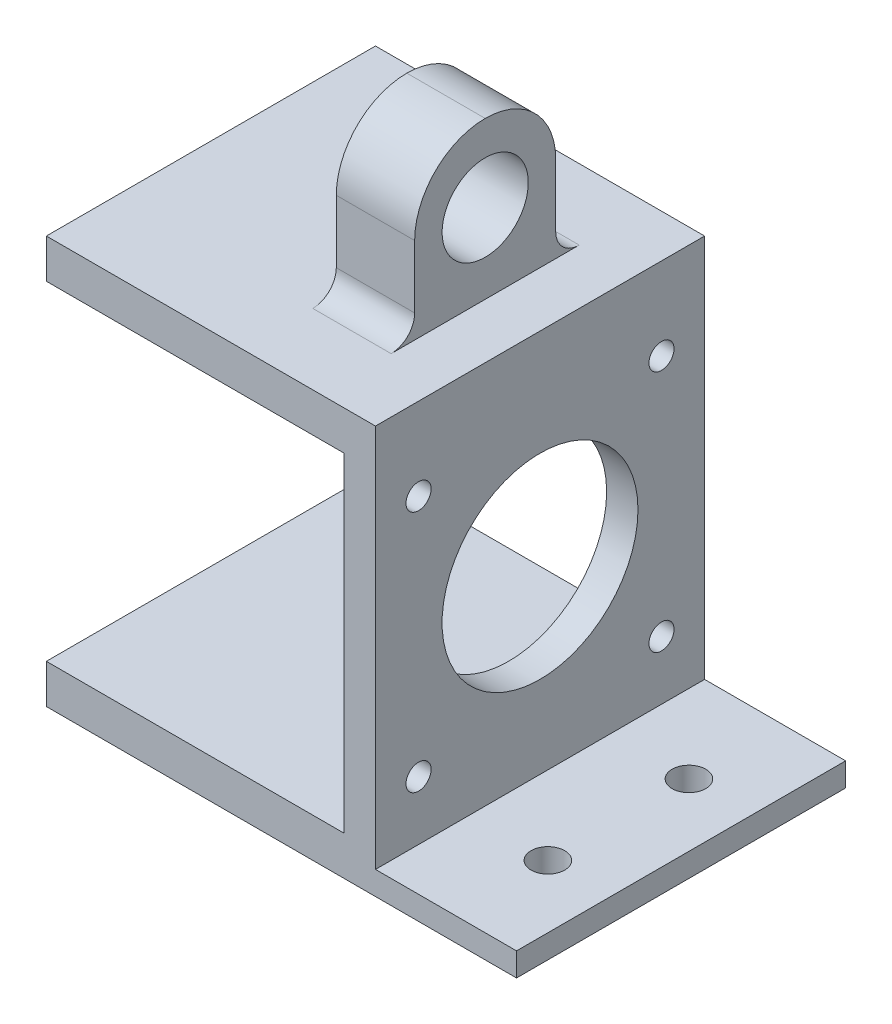
from build123d import *

# Parameters (mm, degrees)
SKETCH1_W            = 94
SKETCH1_H            = 42
BOSS_EXTRUDE1_DEPTH  = 3
SKETCH2_W            = 4
SKETCH2_H            = 42
BOSS_EXTRUDE2_DEPTH  = 47
SKETCH3_R            = 12.5
SKETCH3_R_2          = 1.6
CUT_EXTRUDE1_DEPTH   = 114.176852757
SKETCH4_W            = 42
SKETCH4_H            = 5
BOSS_EXTRUDE3_DEPTH  = 40
SKETCH5_W            = 42
SKETCH5_H            = 5
BOSS_EXTRUDE4_DEPTH  = 38
SKETCH7_W            = 42
SKETCH7_H            = 42
SKETCH7_W_2          = 44
BOSS_EXTRUDE6_DEPTH  = 5
SKETCH9_R            = 2.15
CUT_EXTRUDE2_DEPTH   = 149.731301346
SKETCH11_W           = 10
SKETCH11_H           = 18
BOSS_EXTRUDE7_DEPTH  = 20
SKETCH13_R           = 5.5
CUT_EXTRUDE3_DEPTH   = 169.988165266
BOSS_EXTRUDE11_DEPTH = 5
SKETCH23_W           = 10
SKETCH23_H           = 26
BOSS_EXTRUDE12_DEPTH = 50
CUT_EXTRUDE7_DEPTH   = 193.595430891
SKETCH25_W           = 10
SKETCH25_H           = 18
BOSS_EXTRUDE13_DEPTH = 20
SKETCH26_R           = 5.5
CUT_EXTRUDE8_DEPTH   = 193.595430891
SKETCH27_W           = 12
SKETCH27_H           = 18
BOSS_EXTRUDE14_DEPTH = 69
CUT_EXTRUDE10_START  = -5
SKETCH28_R           = 5.5
CUT_EXTRUDE10_DEPTH  = 5
SKETCH29_R           = 5.5
CUT_EXTRUDE11_DEPTH  = 5
FILLET4_R            = 9
FILLET3_R            = 3
SKETCH30_W           = 112
SKETCH30_H           = 120
CUT_EXTRUDE13_DEPTH  = 181.413414135


# Some blends are built 0.0001 mm under size
with BuildPart() as part:
    # Sketch1 → Boss-Extrude1 (new body)
    with BuildSketch(Plane(origin=(0, 0, 0), x_dir=(1, 0, 0), z_dir=(0, 1, 0))):
        with Locations((47, -21)):
            Rectangle(SKETCH1_W, SKETCH1_H)
    extrude(amount=BOSS_EXTRUDE1_DEPTH)

    # Sketch2 → Boss-Extrude2 (add)
    with BuildSketch(Plane.XZ):
        with Locations((2, 21)):
            Rectangle(SKETCH2_W, SKETCH2_H)
        with Locations((92, 21)):
            Rectangle(SKETCH2_W, SKETCH2_H)
    extrude(amount=-BOSS_EXTRUDE2_DEPTH)

    # Sketch3 → Cut-Extrude1 (cut, through all)
    with BuildSketch(Plane(origin=(94, 0, 0), x_dir=(0, 0, -1), z_dir=(1, 0, 0))):
        with Locations((-21, 26)):
            Circle(SKETCH3_R)
        with Locations((-36.5, 41.5)):
            Circle(SKETCH3_R_2)
        with Locations((-5.5, 41.5)):
            Circle(SKETCH3_R_2)
        with Locations((-36.5, 10.5)):
            Circle(SKETCH3_R_2)
        with Locations((-5.5, 10.5)):
            Circle(SKETCH3_R_2)
    extrude(amount=-CUT_EXTRUDE1_DEPTH, mode=Mode.SUBTRACT)

    # Sketch4 → Boss-Extrude3 (add)
    with BuildSketch(Plane(origin=(94, 0, 0), x_dir=(0, 0, -1), z_dir=(1, 0, 0))):
        with Locations((-21, 2.5)):
            Rectangle(SKETCH4_W, SKETCH4_H)
    extrude(amount=BOSS_EXTRUDE3_DEPTH)

    # Sketch5 → Boss-Extrude4 (add)
    with BuildSketch(Plane.ZY):
        with Locations((21, 2.5)):
            Rectangle(SKETCH5_W, SKETCH5_H)
    extrude(amount=BOSS_EXTRUDE4_DEPTH)

    # Sketch7 → Boss-Extrude6 (add)
    with BuildSketch(Plane(origin=(0, 47, 0), x_dir=(1, 0, 0), z_dir=(0, 1, 0))):
        with Locations((-17, -21)):
            Rectangle(SKETCH7_W, SKETCH7_H)
        with Locations((112, -21)):
            Rectangle(SKETCH7_W_2, SKETCH7_H)
    extrude(amount=BOSS_EXTRUDE6_DEPTH)

    # Sketch9 → Cut-Extrude2 (cut, through all)
    with BuildSketch(Plane(origin=(0, 3, 0), x_dir=(1, 0, 0), z_dir=(0, 1, 0))):
        with Locations(Location((83, -20, 0), (0, 0, 270))):
            Circle(SKETCH9_R)
        with Locations(Location((65, -20, 0), (0, 0, 270))):
            Circle(SKETCH9_R)
        with Locations(Location((74, -11, 0), (0, 0, 270))):
            Circle(SKETCH9_R)
        with Locations(Location((74, -29, 0), (0, 0, 270))):
            Circle(SKETCH9_R)
        with Locations(Location((14, -12, 0), (0, 0, 270))):
            Circle(SKETCH9_R)
        with Locations(Location((14, -30, 0), (0, 0, 270))):
            Circle(SKETCH9_R)
        with Locations(Location((30, -12, 0), (0, 0, 270))):
            Circle(SKETCH9_R)
        with Locations(Location((30, -30, 0), (0, 0, 270))):
            Circle(SKETCH9_R)
    extrude(amount=-CUT_EXTRUDE2_DEPTH, mode=Mode.SUBTRACT)

    # Sketch11 → Boss-Extrude7 (add)
    with BuildSketch(Plane(origin=(0, 52, 0), x_dir=(1, 0, 0), z_dir=(0, 1, 0))):
        with Locations((-8, -21)):
            Rectangle(SKETCH11_W, SKETCH11_H)
        with Locations((107, -21)):
            Rectangle(SKETCH11_W, SKETCH11_H)
    extrude(amount=BOSS_EXTRUDE7_DEPTH)

    # Sketch13 → Cut-Extrude3 (cut, through all)
    with BuildSketch(Plane.ZY.offset(13)):
        with Locations((21, 62.15)):
            Circle(SKETCH13_R)
    extrude(amount=-CUT_EXTRUDE3_DEPTH, mode=Mode.SUBTRACT)

    # Sketch20 → Boss-Extrude11 (add)
    with BuildSketch(Plane.XY.offset(42)):
        Polygon((134, 0), (134, 52), (90, 52), (90, 0), (95, 0), (95, 20), (102, 26), (112, 26), (129, 20), (129, 0), align=None)
    extrude(amount=BOSS_EXTRUDE11_DEPTH)

    # Sketch23 → Boss-Extrude12 (add)
    with BuildSketch(Plane.XY.offset(47)):
        with Locations((107, 39)):
            Rectangle(SKETCH23_W, SKETCH23_H)
    extrude(amount=BOSS_EXTRUDE12_DEPTH)

    # Sketch24 → Cut-Extrude7 (cut, through all)
    with BuildSketch(Plane(origin=(112, 0, 0), x_dir=(0, 0, -1), z_dir=(1, 0, 0))):
        Polygon((-47, 26), (-97, 39), (-97, 26), align=None)
    extrude(amount=-CUT_EXTRUDE7_DEPTH, mode=Mode.SUBTRACT)

    # Sketch25 → Boss-Extrude13 (add)
    with BuildSketch(Plane(origin=(0, 52, 0), x_dir=(1, 0, 0), z_dir=(0, 1, 0))):
        with Locations((107, -71)):
            Rectangle(SKETCH25_W, SKETCH25_H)
    extrude(amount=BOSS_EXTRUDE13_DEPTH)

    # Sketch26 → Cut-Extrude8 (cut, through all)
    with BuildSketch(Plane(origin=(112, 0, 0), x_dir=(0, 0, -1), z_dir=(1, 0, 0))):
        with Locations((-71, 62.15)):
            Circle(SKETCH26_R)
    extrude(amount=-CUT_EXTRUDE8_DEPTH, mode=Mode.SUBTRACT)

    # Sketch27 → Boss-Extrude14 (add)
    with BuildSketch(Plane(origin=(0, 3, 0), x_dir=(1, 0, 0), z_dir=(0, 1, 0))):
        with Locations((47, -21)):
            Rectangle(SKETCH27_W, SKETCH27_H)
    extrude(amount=BOSS_EXTRUDE14_DEPTH)

    # Sketch28 → Cut-Extrude10 (cut)
    with BuildSketch(Plane(origin=(53, 0, 0), x_dir=(0, 0, -1), z_dir=(1, 0, 0)).offset(CUT_EXTRUDE10_START)):
        with Locations(Location((-21, 62.15, 0), (0, 0, 180))):
            Circle(SKETCH28_R)
    extrude(amount=CUT_EXTRUDE10_DEPTH, mode=Mode.SUBTRACT)

    # Sketch29 → Cut-Extrude11 (cut)
    with BuildSketch(Plane.ZY.offset(-41)):
        with Locations((21, 62.15)):
            Circle(SKETCH29_R)
    extrude(amount=-CUT_EXTRUDE11_DEPTH, mode=Mode.SUBTRACT)

    # Fillet4
    fillet4_edges = [part.edges().sort_by_distance(p)[0] for p in [
        (-8, 72, 12),
        (-8, 72, 30),
        (107, 72, 12),
        (107, 72, 30),
        (107, 72, 62),
        (107, 72, 80),
        (47, 72, 12),
        (47, 72, 30),
    ]]
    fillet(fillet4_edges, radius=FILLET4_R - 0.0001)  # a hair under: the kernel refuses the full size

    # Fillet3
    # the kernel refuses this fillet: 3 mm, written as the material it adds along each edge
    with BuildSketch(Plane(origin=(-3, 52, 30), x_dir=(0, 1, 0), z_dir=(-1, 0, 0)), Plane(origin=(112, 52, 80), x_dir=(0, 1, 0), z_dir=(-1, 0, 0))) as fillet3_piece_1:
        with BuildLine():
            CenterArc((FILLET3_R, -FILLET3_R), FILLET3_R, 90, 90)
            Line((0, -FILLET3_R), (0, 0))
            Line((0, 0), (FILLET3_R, 0))
        make_face()
    extrude(amount=10)
    with BuildSketch(Plane(origin=(-13, 52, 12), x_dir=(0, 0, -1), z_dir=(1, 0, 0)), Plane(origin=(112, 52, 30), x_dir=(0, 0, 1), z_dir=(-1, 0, 0)), Plane(origin=(102, 52, 12), x_dir=(0, 0, -1), z_dir=(1, 0, 0)), Plane(origin=(102, 52, 62), x_dir=(0, 0, -1), z_dir=(1, 0, 0))) as fillet3_piece_2:
        with BuildLine():
            CenterArc((FILLET3_R, FILLET3_R), FILLET3_R, 180, 90)
            Line((0, FILLET3_R), (0, 0))
            Line((0, 0), (FILLET3_R, 0))
        make_face()
    extrude(amount=10)
    with BuildSketch(Plane(origin=(95, 20, 42), x_dir=(0, -1, 0), z_dir=(0, 0, 1))) as fillet3_piece_3:
        with BuildLine():
            CenterArc((FILLET3_R * 0.45993492247, FILLET3_R), FILLET3_R, 220.601294645, 49.398705355)
            Line((-FILLET3_R * 0.299321679895, FILLET3_R * 0.349208626544), (0, 0))
            Line((0, 0), (FILLET3_R * 0.45993492247, 0))
        make_face()
    extrude(amount=5)
    with BuildSketch(Plane(origin=(102, 26, 42), x_dir=(-0.7592566023652966, -0.6507913734559685, 0), z_dir=(0, 0, 1))) as fillet3_piece_4:
        with BuildLine():
            CenterArc((FILLET3_R * 0.369924076215, FILLET3_R), FILLET3_R, 229.398705355, 40.601294645)
            Line((-FILLET3_R * 0.28086729724, FILLET3_R * 0.240743397635), (0, 0))
            Line((0, 0), (FILLET3_R * 0.369924076215, 0))
        make_face()
    extrude(amount=5)
    with BuildSketch(Plane(origin=(112, 26, 42), x_dir=(0.942990333582889, -0.3328201177351389, 0), z_dir=(0, 0, 1))) as fillet3_piece_5:
        with BuildLine():
            CenterArc((FILLET3_R * 0.171292729553, -FILLET3_R), FILLET3_R, 90, 19.440034828)
            Line((-FILLET3_R * 0.161527388182, -FILLET3_R * 0.0570096664171), (0, 0))
            Line((0, 0), (FILLET3_R * 0.171292729553, 0))
        make_face()
    extrude(amount=5)
    with BuildSketch(Plane(origin=(129, 20, 42), x_dir=(0, -1, 0), z_dir=(0, 0, 1))) as fillet3_piece_6:
        with BuildLine():
            CenterArc((FILLET3_R * 0.707515081019, -FILLET3_R), FILLET3_R, 90, 70.559965172)
            Line((-FILLET3_R * 0.235475252564, -FILLET3_R * 0.667179882265), (0, 0))
            Line((0, 0), (FILLET3_R * 0.707515081019, 0))
        make_face()
    extrude(amount=5)
    with BuildSketch(Plane(origin=(53, 3, 30), x_dir=(0, 0, 1), z_dir=(-1, 0, 0)), Plane(origin=(41, 3, 12), x_dir=(0, 0, -1), z_dir=(1, 0, 0))) as fillet3_piece_7:
        with BuildLine():
            CenterArc((FILLET3_R, FILLET3_R), FILLET3_R, 180, 90)
            Line((0, FILLET3_R), (0, 0))
            Line((0, 0), (FILLET3_R, 0))
        make_face()
    extrude(amount=12)
    # the kernel refuses this fillet: 3 mm, written as the material it takes off along each edge
    with BuildSketch(Plane(origin=(94.5, 52, 97), x_dir=(0, 0, -1), z_dir=(1, 0, 0))) as fillet3_2_piece_1:
        with BuildLine():
            CenterArc((FILLET3_R, -FILLET3_R), FILLET3_R, 90, 90)
            Line((0, -FILLET3_R), (0, 0))
            Line((0, 0), (FILLET3_R, 0))
        make_face()
    extrude(amount=25, mode=Mode.SUBTRACT)
    with BuildSketch(Plane(origin=(117.799354812, 39, 97), x_dir=(0, -0.25163385176495195, -0.9678225067882716), z_dir=(-1, 0, 0))) as fillet3_2_piece_2:
        with BuildLine():
            CenterArc((FILLET3_R * 0.773247308247, -FILLET3_R), FILLET3_R, 90, 75.425783802)
            Line((-FILLET3_R * 0.194575198541, -FILLET3_R * 0.748366148235), (0, 0))
            Line((0, 0), (FILLET3_R * 0.773247308247, 0))
        make_face()
    extrude(amount=21.598709624, mode=Mode.SUBTRACT)

    # Sketch30 → Cut-Extrude13 (cut, through all)
    with BuildSketch(Plane.XZ):
        with Locations((78, 60)):
            Rectangle(SKETCH30_W, SKETCH30_H)
    extrude(amount=-CUT_EXTRUDE13_DEPTH, mode=Mode.SUBTRACT)


solid = part.part
